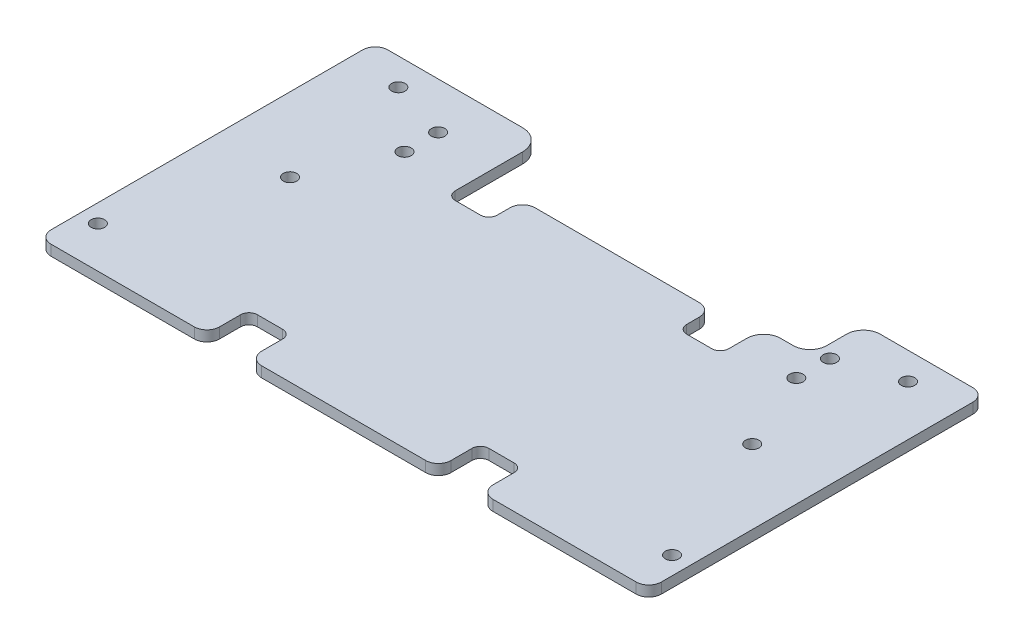
from build123d import *

# Parameters (mm, degrees)
BOSS_EXTRUDE1_DEPTH = 3.175
FILLET1_R           = 3.81
SKETCH2_R           = 2.032
CUT_EXTRUDE1_DEPTH  = 211.342252353
FILLET2_R           = 6.35
FILLET3_R           = 2.54
FILLET4_R           = 3.81
FILLET5_R           = 3.81
CUT_EXTRUDE4_DEPTH  = 211.342252353
FILLET9_R           = 5.08


with BuildPart() as part:
    # Sketch1 → Boss-Extrude1 (new body)
    with BuildSketch(Plane(origin=(0, 0, 0), x_dir=(1, 0, 0), z_dir=(0, 1, 0))):
        Polygon((50.8, 0), (0, 0), (0, -101.6), (50.8, -101.6), (50.8, -88.9), (63.5, -88.9), (63.5, -101.6), (120.65, -101.6), (120.65, -88.9), (133.35, -88.9), (133.35, -101.6), (184.15, -101.6), (184.15, 0), (133.35, 0), (133.35, -29.21), (120.65, -29.21), (120.65, -19.05), (63.5, -19.05), (63.5, -29.21), (50.8, -29.21), align=None)
    extrude(amount=BOSS_EXTRUDE1_DEPTH)

    # Fillet1
    fillet1_edges = [part.edges().sort_by_distance(p)[0] for p in [
        (184.15, 1.5875, 101.6),
        (0, 1.5875, 101.6),
        (184.15, 1.5875, 0),
        (0, 1.5875, 0),
    ]]
    fillet(fillet1_edges, radius=FILLET1_R)

    # Sketch2 → Cut-Extrude1 (cut, through all)
    with BuildSketch(Plane(origin=(0, 3.175, 0), x_dir=(1, 0, 0), z_dir=(0, 1, 0))):
        with Locations((5.437401114, -89.146320086)):
            Circle(SKETCH2_R)
        with Locations((178.712598886, -89.146320086)):
            Circle(SKETCH2_R)
        with Locations((22.338907609, -48.03498858)):
            Circle(SKETCH2_R)
        with Locations((15.16630044, -8.195189781)):
            Circle(SKETCH2_R)
        with Locations((32.94630044, -24.13)):
            Circle(SKETCH2_R)
        with Locations((32.94630044, -13.97)):
            Circle(SKETCH2_R)
        with Locations((161.811092391, -48.03498858)):
            Circle(SKETCH2_R)
        with Locations((151.20369956, -24.13)):
            Circle(SKETCH2_R)
        with Locations((151.20369956, -13.97)):
            Circle(SKETCH2_R)
        with Locations((168.98369956, -8.195189781)):
            Circle(SKETCH2_R)
    extrude(amount=-CUT_EXTRUDE1_DEPTH, mode=Mode.SUBTRACT)

    # Fillet2
    fillet2_edges = [part.edges().sort_by_distance(p)[0] for p in [
        (50.8, 1.5875, 0),
        (133.35, 1.5875, 0),
    ]]
    fillet(fillet2_edges, radius=FILLET2_R)

    # Fillet3
    fillet3_edges = [part.edges().sort_by_distance(p)[0] for p in [
        (133.35, 1.5875, 29.21),
        (120.65, 1.5875, 29.21),
        (50.8, 1.5875, 29.21),
        (63.5, 1.5875, 29.21),
        (133.35, 1.5875, 88.9),
        (120.65, 1.5875, 88.9),
        (63.5, 1.5875, 88.9),
        (50.8, 1.5875, 88.9),
    ]]
    fillet(fillet3_edges, radius=FILLET3_R)

    # Fillet4
    fillet4_edges = [part.edges().sort_by_distance(p)[0] for p in [
        (120.65, 1.5875, 19.05),
        (63.5, 1.5875, 19.05),
    ]]
    fillet(fillet4_edges, radius=FILLET4_R)

    # Fillet5
    fillet5_edges = [part.edges().sort_by_distance(p)[0] for p in [
        (133.35, 1.5875, 101.6),
        (120.65, 1.5875, 101.6),
        (63.5, 1.5875, 101.6),
        (50.8, 1.5875, 101.6),
    ]]
    fillet(fillet5_edges, radius=FILLET5_R)

    # Sketch8 → Cut-Extrude4 (cut, through all)
    with BuildSketch(Plane.XZ):
        with BuildLine():
            Line((139.7, 0), (147.32, 0))
            Line((147.32, 0), (147.32, 16.118813411))
            Line((147.32, 16.118813411), (133.35, 16.118813411))
            Line((133.35, 16.118813411), (133.35, 6.35))
            ThreePointArc((133.35, 6.35), (135.209871939, 1.859871939), (139.7, 0))
        make_face()
    extrude(amount=-CUT_EXTRUDE4_DEPTH, mode=Mode.SUBTRACT)

    # Fillet9
    fillet9_edges = [part.edges().sort_by_distance(p)[0] for p in [
        (133.35, 1.5875, 16.118813411),
        (147.32, 1.5875, 0),
        (147.32, 1.5875, 16.118813411),
    ]]
    fillet(fillet9_edges, radius=FILLET9_R)


solid = part.part
